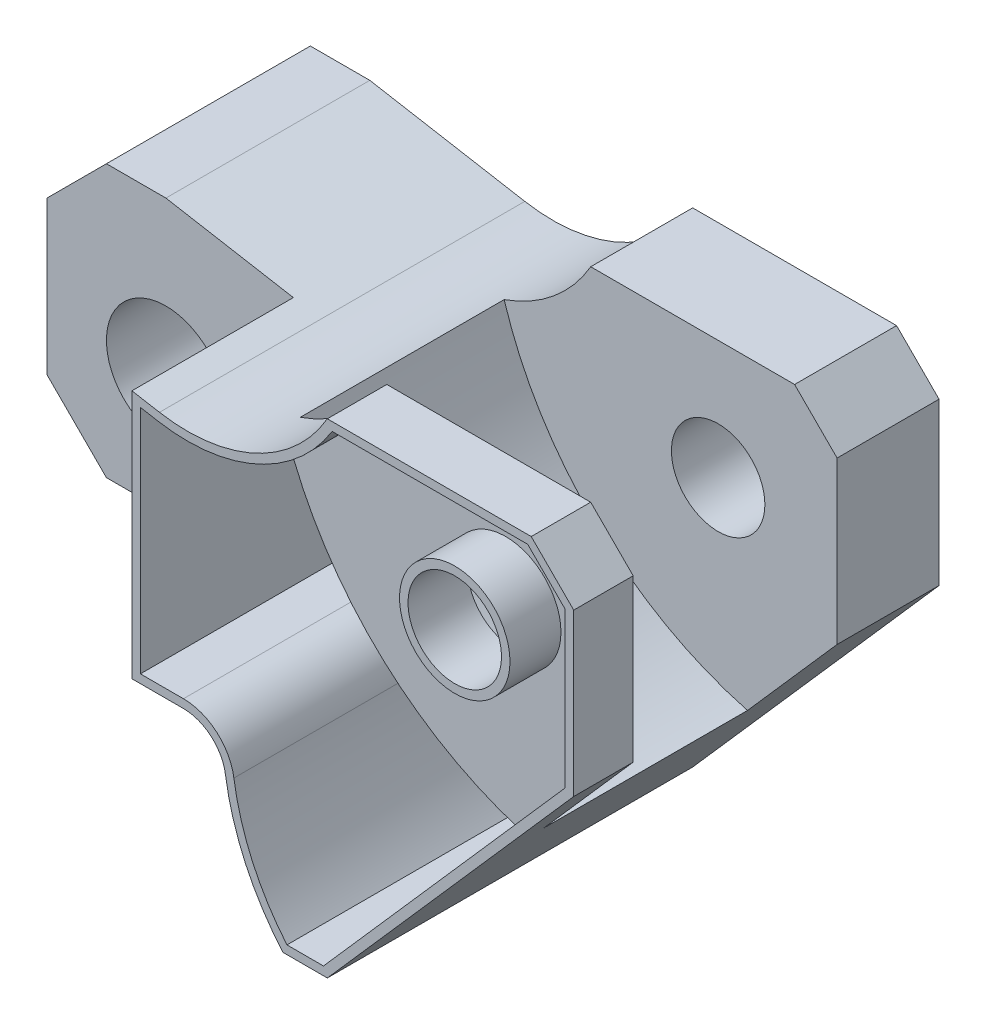
from build123d import *

# Parameters (mm, degrees)
SKETCH2_R               = 7
BOSS_EXTRUDE1_DEPTH     = 43
SKETCH3_R               = 5.5
CUT_EXTRUDE1_DEPTH      = 108.976849371
CUT_EXTRUDE2_DEPTH      = 108.976849371
CUT_EXTRUDE2_DEPTH_BACK = 19
SKETCH4_R               = 7
CUT_EXTRUDE12_START     = -24
CUT_EXTRUDE12_DEPTH     = 24
SHELL2_START            = 12
SHELL2_DEPTH            = 31
SHELL2_START_2          = 37
SHELL2_2_OUTLINE_R      = 6.5
SHELL2_2_DEPTH          = 6


# Read off the part's stored shape, not the designer's step: Shell2
with BuildPart() as part:
    # Sketch2 → Boss-Extrude1 (new body)
    with BuildSketch(Plane.XY):
        with BuildLine():
            Line((76, 57), (81, 52))
            Line((81, 52), (81, 33))
            Line((81, 33), (52, 0))
            Line((52, 0), (46.788067397, 0))
            ThreePointArc((46.788067397, 0), (42.3490952, 6.884327939), (40.012264997, 14.735294118))
            ThreePointArc((40.012264997, 14.735294118), (38.331862036, 17.786586232), (35.066626255, 19))
            Line((35.066626255, 19), (7, 19))
            Line((7, 19), (0, 26))
            Line((0, 26), (0, 44))
            Line((0, 44), (7, 51))
            Line((7, 51), (14, 51))
            Line((14, 51), (32.243084988, 47.783251905))
            ThreePointArc((32.243084988, 47.783251905), (43.574972961, 49.276069151), (52, 57))
            Line((52, 57), (76, 57))
        make_face()
        with Locations((14, 33)):
            Circle(SKETCH2_R, mode=Mode.SUBTRACT)
    extrude(amount=BOSS_EXTRUDE1_DEPTH)

    # Sketch3 → Cut-Extrude1 (cut, through all)
    with BuildSketch(Plane.XY.offset(43)):
        with Locations((67, 43)):
            Circle(SKETCH3_R)
    extrude(amount=-CUT_EXTRUDE1_DEPTH, mode=Mode.SUBTRACT)

    # Sketch4 → Cut-Extrude2 (cut, two sides: drawn at the far end of the back side and taken through both)
    with BuildSketch(Plane.XY.offset(43).offset(-CUT_EXTRUDE2_DEPTH_BACK)):
        Polygon((29, 19), (29, 48.355095289), (14, 51), (7, 51), (0, 44), (0, 26), (7, 19), align=None)
        with Locations((14, 33)):
            Circle(SKETCH4_R, mode=Mode.SUBTRACT)
    extrude(amount=CUT_EXTRUDE2_DEPTH + CUT_EXTRUDE2_DEPTH_BACK, mode=Mode.SUBTRACT)

    # Sketch7 → Cut-Extrude12 (cut)
    with BuildSketch(Plane.XY.offset(36).offset(CUT_EXTRUDE12_START)):
        with BuildLine():
            ThreePointArc((52, 57), (47.665353397, 51.864697991), (41.814145925, 48.559571819))
            ThreePointArc((41.814145925, 48.559571819), (52.571435773, 31.077146254), (70.454545455, 21))
            Line((70.454545455, 21), (81, 33))
            Line((81, 33), (81, 52))
            Line((81, 52), (76, 57))
            Line((76, 57), (52, 57))
        make_face()
    extrude(amount=CUT_EXTRUDE12_DEPTH, mode=Mode.SUBTRACT)

    # Shell2 outline → Shell2 (cut)
    with BuildSketch(Plane.XY.offset(SHELL2_START)):
        with BuildLine():
            Line((51.547522264, 1), (68.661045623, 20.47400934))
            ThreePointArc((68.661045623, 20.47400934), (51.667497173, 30.560606948), (41.16767498, 47.301989033))
            ThreePointArc((41.16767498, 47.301989033), (36.647615315, 46.525160064), (32.06943681, 46.798444152))
            Line((32.06943681, 46.798444152), (30, 47.163341697))
            Line((30, 47.163341697), (30, 20))
            Line((30, 20), (35.066626255, 20))
            ThreePointArc((35.066626255, 20), (38.984909193, 18.543903479), (41.001392745, 14.882352941))
            ThreePointArc((41.001392745, 14.882352941), (43.163792236, 7.508400948), (47.249359107, 1))
            Line((47.249359107, 1), (51.547522264, 1))
        make_face()
    extrude(amount=SHELL2_DEPTH, mode=Mode.SUBTRACT)

    # Shell2 2 outline → Shell2 2 (cut)
    with BuildSketch(Plane.XY.offset(SHELL2_START_2)):
        with BuildLine():
            Line((68.661045623, 20.47400934), (80, 33.376957423))
            Line((80, 33.376957423), (80, 51.585786438))
            Line((80, 51.585786438), (75.585786438, 56))
            Line((75.585786438, 56), (52.567775172, 56))
            ThreePointArc((52.567775172, 56), (47.674046111, 50.594185021), (41.16767498, 47.301989034))
            ThreePointArc((41.16767498, 47.301989034), (51.667497173, 30.560606948), (68.661045623, 20.47400934))
        make_face()
        with Locations((67, 43)):
            Circle(SHELL2_2_OUTLINE_R, mode=Mode.SUBTRACT)
    extrude(amount=SHELL2_2_DEPTH, mode=Mode.SUBTRACT)


solid = part.part
